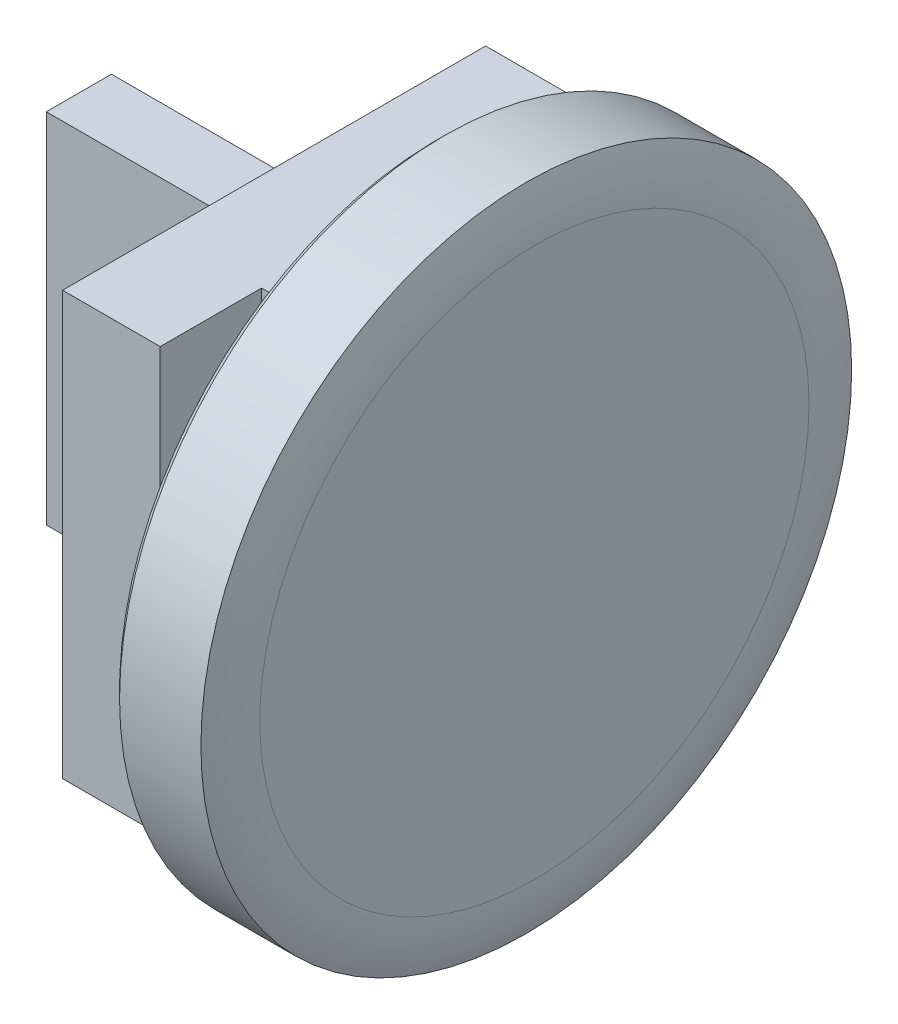
from build123d import *

# Parameters (mm, degrees)
SZKIC1_W                    = 3
SZKIC1_H                    = 13
DODANIE_WYCI_GNI_CIE2_DEPTH = 13
SZKIC3_W                    = 6.769810996
SZKIC3_H                    = 13
DODANIE_WYCI_GNI_CIE3_DEPTH = 2
SZKIC4_R                    = 10
DODANIE_WYCI_GNI_CIE4_DEPTH = 3
SFAZOWANIE1_SIZE            = 0.25
SFAZOWANIE2_SIZE            = 0.25
ZAOKR_GLENIE2_R             = 5
SZKIC5_W                    = 2
SZKIC5_H                    = 11
DODANIE_WYCI_GNI_CIE5_DEPTH = 6
SZKIC8_W                    = 1
SZKIC8_H                    = 4
WYTNIJ_WYCI_GNI_CIE1_DEPTH  = 6


with BuildPart() as part:
    # Szkic1 → Dodanie-wyciągnięcie2 (new body)
    with BuildSketch(Plane(origin=(0, 0, 0), x_dir=(1, 0, 0), z_dir=(0, 1, 0))):
        Rectangle(SZKIC1_W, SZKIC1_H)
    extrude(amount=DODANIE_WYCI_GNI_CIE2_DEPTH)

    # Szkic3 → Dodanie-wyciągnięcie3 (add)
    with BuildSketch(Plane(origin=(1.5, 0, 0), x_dir=(0, 0, -1), z_dir=(1, 0, 0))):
        with Locations((0, 6.5)):
            Rectangle(SZKIC3_W, SZKIC3_H)
    extrude(amount=DODANIE_WYCI_GNI_CIE3_DEPTH)

    # Szkic4 → Dodanie-wyciągnięcie4 (add)
    with BuildSketch(Plane(origin=(3.5, 0, 0), x_dir=(0, 0, -1), z_dir=(1, 0, 0))):
        with Locations((0, 6.5)):
            Circle(SZKIC4_R)
    extrude(amount=DODANIE_WYCI_GNI_CIE4_DEPTH)

    # Sfazowanie1
    sfazowanie1_edges = [part.edges().sort_by_distance(p)[0] for p in [
        (6.5, 6.5, 10),
    ]]
    chamfer(sfazowanie1_edges, length=SFAZOWANIE1_SIZE)

    # Sfazowanie2
    sfazowanie2_edges = [part.edges().sort_by_distance(p)[0] for p in [
        (3.5, 6.5, 10),
    ]]
    chamfer(sfazowanie2_edges, length=SFAZOWANIE2_SIZE)

    # Zaokrąglenie2
    # the kernel refuses this fillet: 5 mm, written as the material it takes off along each edge
    with BuildSketch(Plane(origin=(6.5, 6.5, 0), x_dir=(0, 0, -1), z_dir=(0, -1, 0))) as zaokr_glenie2_piece_1:
        with BuildLine():
            CenterArc((8.4387505, -5), ZAOKR_GLENIE2_R, 71.805127661, 18.194872339)
            Line((8.4387505, 0), (8.4387505, 0.1))
            Line((8.4387505, 0.1), (9.75, 0.1))
            Line((9.75, 0.1), (9.820710678, 0.070710678))
            ThreePointArc((9.820710678, 0.070710678), (9.945710678, -0.054289322), (10.03122499, -0.155))
            Line((10.03122499, -0.155), (10, -0.25))
        make_face()
    revolve(axis=Axis((6.5, 6.5, 0), (1, 0, 0)), mode=Mode.SUBTRACT)

    # Szkic5 → Dodanie-wyciągnięcie5 (add)
    with BuildSketch(Plane.ZY.offset(1.5)):
        with Locations((0, 6.5)):
            Rectangle(SZKIC5_W, SZKIC5_H)
    extrude(amount=DODANIE_WYCI_GNI_CIE5_DEPTH)

    # Szkic8 → Wytnij-wyciągnięcie1 (cut)
    with BuildSketch(Plane(origin=(0, 0, -1), x_dir=(-1, 0, 0), z_dir=(0, 0, -1))):
        with Locations((5, 6.5)):
            Rectangle(SZKIC8_W, SZKIC8_H)
    extrude(amount=-WYTNIJ_WYCI_GNI_CIE1_DEPTH, mode=Mode.SUBTRACT)


solid = part.part
